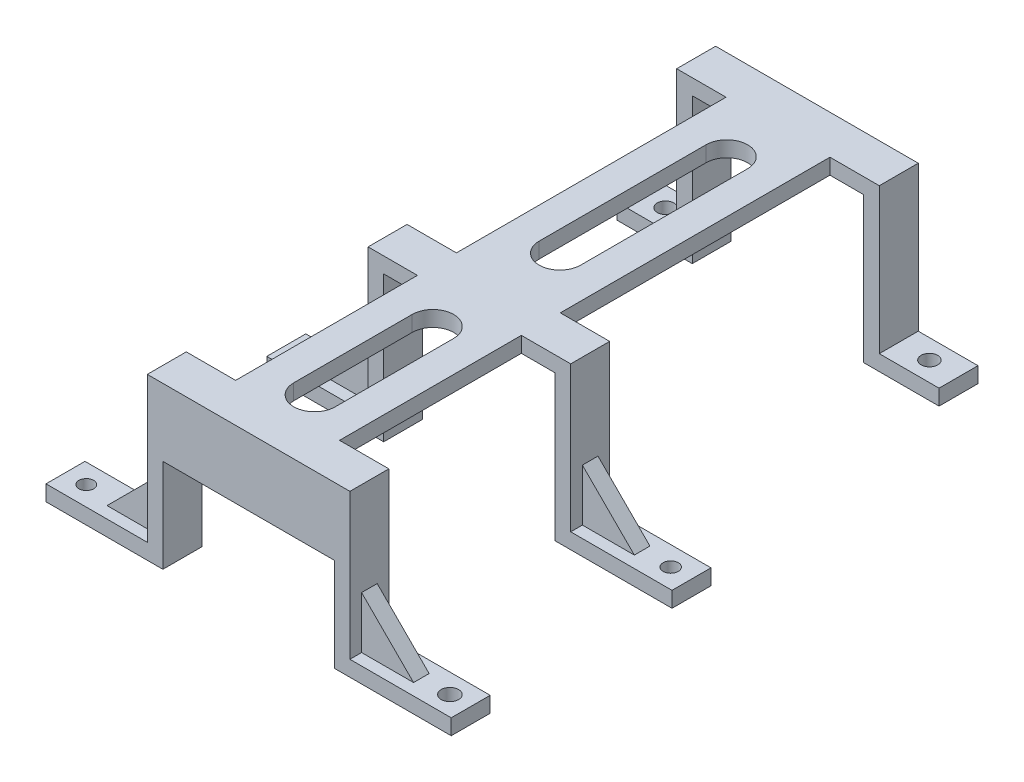
from build123d import *

# Parameters (mm, degrees)
BOSS_EXTRUDE1_DEPTH      = 7.5
SKETCH4_W                = 20
SKETCH4_H                = 3
BOSS_EXTRUDE2_DEPTH      = 35
SKETCH6_W                = 20
SKETCH6_H                = 3
BOSS_EXTRUDE3_DEPTH      = 59.4
SKETCH5_R                = 1.678965669
SKETCH5_R_2              = 1.417070449
SKETCH5_R_3              = 1.591812116
SKETCH5_R_4              = 1.461089302
CUT_EXTRUDE1_DEPTH       = 132.345384388
SKETCH7_R                = 1.6
CUT_EXTRUDE2_DEPTH       = 132.345384388
SKETCH10_W               = 33
SKETCH10_H               = 3
BOSS_EXTRUDE4_DEPTH      = 10
SKETCH11_W               = 8
SKETCH11_H               = 7.5
CUT_EXTRUDE4_DEPTH       = 133.017460966
SKETCH12_W               = 10
SKETCH12_H               = 3
BOSS_EXTRUDE5_DEPTH      = 10
CHAMFER1_SIZE            = 10
CHAMFER1_OF_MIRROR6_SIZE = 10
MIRROR7_START            = -40.25
MIRROR7_DEPTH            = 3
MIRROR7_START_2          = 2.25
MIRROR7_2_DEPTH          = 3
CUT_EXTRUDE5_DEPTH       = 132.345384388


# Read off the part's stored shape, not the designer's step: Mirror7
with BuildPart() as part:
    # Sketch3 → Boss-Extrude1 (new body)
    with BuildSketch(Plane.XY):
        Polygon((0, 0), (19.5, 0), (19.5, 28), (58.5, 28), (58.5, 0), (78, 0), (78, -3), (55.5, -3), (55.5, 25), (22.5, 25), (22.5, -3), (0, -3), align=None)
    boss_extrude1 = extrude(amount=BOSS_EXTRUDE1_DEPTH)

    # Sketch4 → Boss-Extrude2 (add)
    with BuildSketch(Plane(origin=(0, 0, 0), x_dir=(-1, 0, 0), z_dir=(0, 0, -1))):
        with Locations((-39, 26.5)):
            Rectangle(SKETCH4_W, SKETCH4_H)
    extrude(amount=BOSS_EXTRUDE2_DEPTH)

    # Mirror1: Boss-Extrude1 across plane
    add(boss_extrude1.mirror(Plane(origin=(0, 0, -17.5), x_dir=(1, 0, 0), z_dir=(0, 0, -1))))

    # Sketch6 → Boss-Extrude3 (add)
    with BuildSketch(Plane(origin=(0, 0, -42.5), x_dir=(-1, 0, 0), z_dir=(0, 0, -1))):
        with Locations((-39, 26.5)):
            Rectangle(SKETCH6_W, SKETCH6_H)
    extrude(amount=BOSS_EXTRUDE3_DEPTH)

    # Sketch5 → Cut-Extrude1 (cut, through all)
    with BuildSketch(Plane(origin=(0, 0, 0), x_dir=(1, 0, 0), z_dir=(0, 1, 0))):
        with Locations(Location((74, -3.75, 0), (0, 0, 270))):
            Circle(SKETCH5_R)
        with Locations(Location((4, -3.75, 0), (0, 0, 270))):
            Circle(SKETCH5_R_2)
        with Locations(Location((4, 38.75, 0), (0, 0, 270))):
            Circle(SKETCH5_R_3)
        with Locations(Location((74, 38.75, 0), (0, 0, 270))):
            Circle(SKETCH5_R_4)
    extrude(amount=-CUT_EXTRUDE1_DEPTH, mode=Mode.SUBTRACT)

    # Mirror5: Boss-Extrude1 across plane
    add(boss_extrude1.mirror(Plane(origin=(0, 0, -47.2), x_dir=(1, 0, 0), z_dir=(0, 0, -1))))

    # Sketch7 → Cut-Extrude2 (cut, through all)
    with BuildSketch(Plane(origin=(0, 0, 0), x_dir=(1, 0, 0), z_dir=(0, 1, 0))):
        with Locations(Location((64.4, 98.15, 0), (0, 0, 270))):
            Circle(SKETCH7_R)
        with Locations(Location((13.6, 98.15, 0), (0, 0, 270))):
            Circle(SKETCH7_R)
    extrude(amount=-CUT_EXTRUDE2_DEPTH, mode=Mode.SUBTRACT)

    # Sketch10 → Boss-Extrude4 (add)
    with BuildSketch(Plane.XZ.offset(-25)):
        with Locations((39, 6)):
            Rectangle(SKETCH10_W, SKETCH10_H)
    extrude(amount=BOSS_EXTRUDE4_DEPTH)

    # Sketch11 → Cut-Extrude4 (cut, through all)
    with BuildSketch(Plane.XZ.offset(3)):
        with Locations((4, -98.15)):
            Rectangle(SKETCH11_W, SKETCH11_H)
        with Locations((74, -98.15)):
            Rectangle(SKETCH11_W, SKETCH11_H)
    extrude(amount=-CUT_EXTRUDE4_DEPTH, mode=Mode.SUBTRACT)

    # Sketch12 → Boss-Extrude5 (add)
    with BuildSketch(Plane(origin=(0, 0, 0), x_dir=(1, 0, 0), z_dir=(0, 1, 0))):
        with Locations((14.5, 38.75)):
            Rectangle(SKETCH12_W, SKETCH12_H)
    boss_extrude5 = extrude(amount=BOSS_EXTRUDE5_DEPTH)

    # Chamfer1
    chamfer1_edges = [part.edges().sort_by_distance(p)[0] for p in [
        (9.5, 10, -38.75),
    ]]
    chamfer(chamfer1_edges, length=CHAMFER1_SIZE - 0.0001)  # a hair under: the kernel refuses the full size

    # Mirror6: Boss-Extrude5 across plane
    add(boss_extrude5.mirror(Plane.XY.offset(-17.5)))

    # Chamfer1 of Mirror6
    chamfer1_of_mirror6_edges = [part.edges().sort_by_distance(p)[0] for p in [
        (9.5, 10, 3.75),
    ]]
    chamfer(chamfer1_of_mirror6_edges, length=CHAMFER1_OF_MIRROR6_SIZE - 0.0001)  # a hair under: the kernel refuses the full size

    # Mirror7 outline → Mirror7 (add)
    with BuildSketch(Plane.XY.offset(MIRROR7_START)):
        Polygon((58.5, 0), (68.5, 0), (58.5, 10), align=None)
    extrude(amount=MIRROR7_DEPTH)

    # Mirror7 2 outline → Mirror7 2 (add)
    with BuildSketch(Plane.XY.offset(MIRROR7_START_2)):
        Polygon((58.5, 0), (68.5, 0), (58.5, 10), align=None)
    extrude(amount=MIRROR7_2_DEPTH)

    # Sketch13 → Cut-Extrude5 (cut, through all)
    with BuildSketch(Plane.XZ.offset(-25)):
        with BuildLine():
            Line((43, -5.187147638), (43, -27.972265557))
            ThreePointArc((43, -27.972265557), (39, -31.972265557), (35, -27.972265557))
            Line((35, -27.972265557), (35, -5.187147638))
            ThreePointArc((35, -5.187147638), (39, -1.187147638), (43, -5.187147638))
        make_face()
        with BuildLine():
            Line((43, -52.417226503), (43, -84.557823303))
            ThreePointArc((43, -84.557823303), (39, -88.557823303), (35, -84.557823303))
            Line((35, -84.557823303), (35, -52.417226503))
            ThreePointArc((35, -52.417226503), (39, -48.417226503), (43, -52.417226503))
        make_face()
    extrude(amount=-CUT_EXTRUDE5_DEPTH, mode=Mode.SUBTRACT)


solid = part.part
